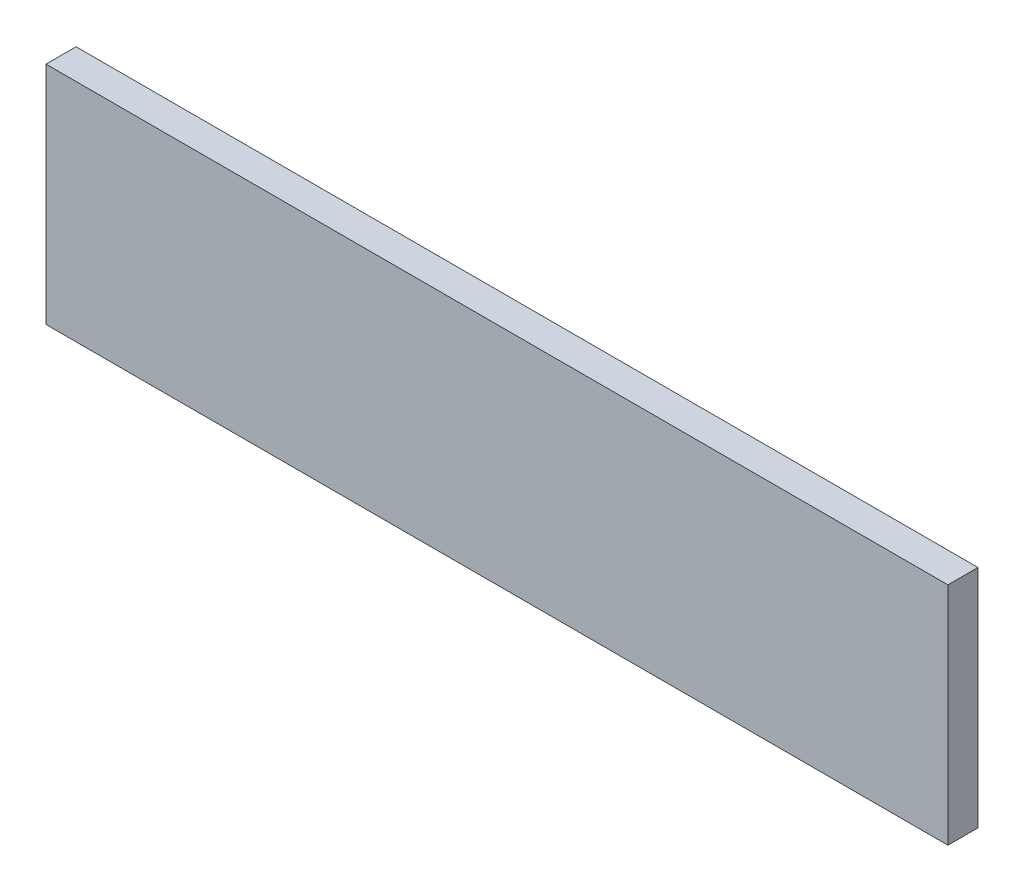
from build123d import *

# Parameters (mm, degrees)
SKIZZE1_W               = 300
SKIZZE1_H               = 75
LINEAR_AUSTRAGEN1_DEPTH = 10


with BuildPart() as part:
    # Skizze1 → Linear austragen1 (new body)
    with BuildSketch(Plane.XY):
        with Locations((0, -112.5)):
            Rectangle(SKIZZE1_W, SKIZZE1_H)
    extrude(amount=LINEAR_AUSTRAGEN1_DEPTH)


solid = part.part
